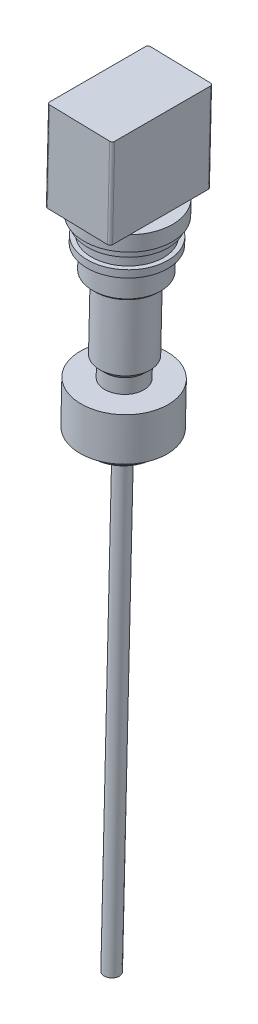
from build123d import *

# Parameters (mm, degrees)
CHAMFER1_SIZE       = 5
CHAMFER2_SIZE       = 2
SKETCH2_W           = 51
SKETCH2_H           = 79
BOSS_EXTRUDE1_DEPTH = 71
FILLET1_R           = 2


with BuildPart() as part:
    # Sketch1 → Revolve2 (revolve)
    with BuildSketch(Plane.XY):
        Polygon((387.82109188, 517.961255794), (388.108543141, 529.957812458), (353.118586206, 530.796211969), (340.38333201, -0.699799139), (346.381610341, -0.843524769), (355.116501156, 363.700406109), (374.860833998, 363.227309242), (375.076422443, 372.22472674), (383.823911677, 372.015126862), (384.638356916, 406.005370741), (365.643808866, 406.460501904), (365.907305855, 417.457345512), (370.406014604, 417.349551289), (371.867225181, 478.33204766), (378.865216568, 478.164367758), (379.344302003, 498.158628863), (384.342867279, 498.038857504), (384.479406628, 503.737221919), (380.980410934, 503.82106187), (381.186417671, 512.418594146), (384.685413365, 512.334754195), (384.821952714, 518.03311861), align=None)
    revolve(axis=Axis((340.38333201, -0.699799139, 0), (0.023954271746676543, 0.9997130552639024, 0)))

    # Chamfer1
    # the kernel refuses this chamfer: 5 mm, written as the material it takes off along each edge
    with BuildSketch(Plane(origin=(350.411753499, 417.828636724, 0), x_dir=(0.9997130552639024, -0.02395427174667721, 0), z_dir=(0, 0, 1))) as chamfer1_piece_1_section:
        Polygon((20 - CHAMFER1_SIZE, 0), (20, CHAMFER1_SIZE), (20, 0), align=None)
    chamfer1_piece_1 = revolve(axis=Axis((350.411753499, 417.828636724, 0), (0.023954271746676543, 0.9997130552639024, 0)), mode=Mode.PRIVATE)
    chamfer1_piece_1 = chamfer1_piece_1 - Plane(origin=(350.477356387, 420.56652265, 0), x_dir=(0.9997130552639024, -0.023954271746676543, 0), z_dir=(0.023954271746676543, 0.9997130552639024, 0)) * Cylinder(15.5, 80, mode=Mode.PRIVATE)
    add(chamfer1_piece_1, mode=Mode.SUBTRACT)

    # Chamfer2
    chamfer2_edges = [part.edges().sort_by_distance(p)[0] for p in [
        (324.880711583, 479.457898432, 0),
        (323.375611652, 364.460954237, 0),
    ]]
    chamfer(chamfer2_edges, length=CHAMFER2_SIZE)

    # Sketch2 → Boss-Extrude1 (add)
    with BuildSketch(Plane(origin=(12.913810212, 538.947908709, 0), x_dir=(0.9997130552639024, -0.023954271746676654, 0), z_dir=(0.023954271746676657, 0.9997130552639025, 0))):
        with Locations((340.302423983, 0)):
            Rectangle(SKETCH2_W, SKETCH2_H)
    extrude(amount=BOSS_EXTRUDE1_DEPTH)

    # Fillet1
    fillet1_edges = [part.edges().sort_by_distance(p)[0] for p in [
        (328.476279944, 566.89685936, -39.5),
        (328.476279944, 566.89685936, 39.5),
        (379.461645763, 565.675191501, 39.5),
        (379.461645763, 565.675191501, -39.5),
    ]]
    fillet(fillet1_edges, radius=FILLET1_R)


solid = part.part
